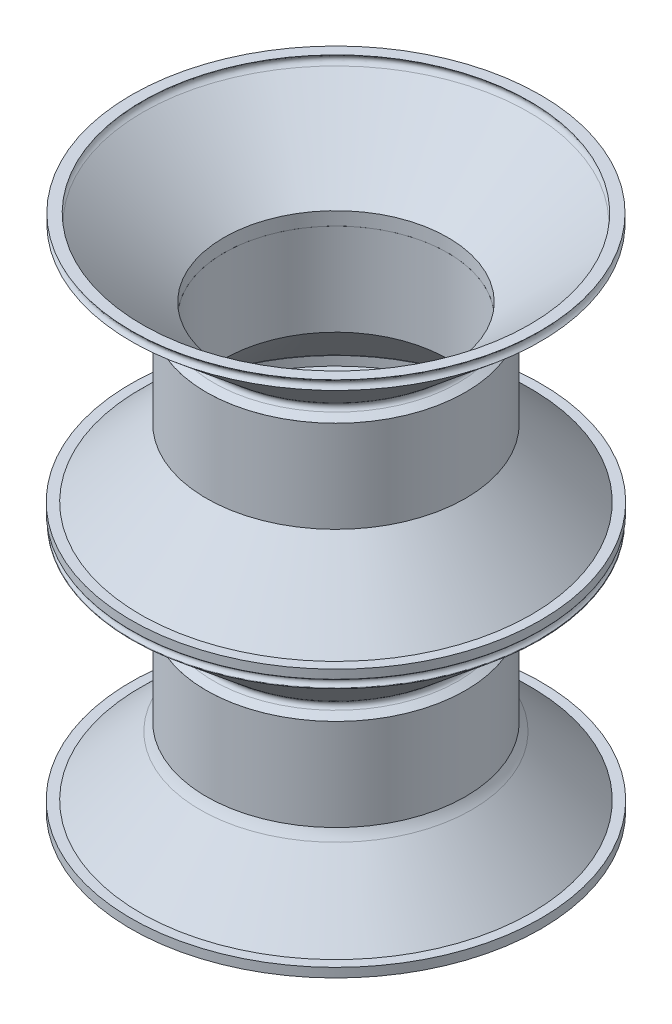
from build123d import *

# Parameters (mm, degrees)
ACTIVE_FILLET_R     = 0.5
SKETCH11_R          = 14.103676921920666
SKETCH11_R_2        = 12.180725781348816
COLLAR_DEPTH        = 10
SKETCH18_R          = 22.29457906148835
SKETCH18_R_2        = 19.511828541936428
BOSS_EXTRUDE4_DEPTH = 1
FILLET3_R           = 0.05
FILLET4_R           = 0.05
FILLET5_R           = 4


# Read off the part's stored shape, not the designer's step: Body-Move/Copy2
with BuildPart() as part:
    # Sketch1 → Main Active (revolve)
    with BuildSketch(Plane.XY):
        Polygon((-0.44430417046757187, 0), (-9.97833291122136, 8), (-8.733753849733018, 8), (0.08552036891816808, 0.5997502558785777), (0.08552036891816808, -0.8481847341285212), (-1.8374307716536824, -0.8481847341285211), align=None)
    revolve(axis=Axis((12.266246150266982, 7.609018032819944, 0), (1.1e-16, -1, 0)))

    # Active fillet
    active_fillet_edges = [part.edges().sort_by_distance(p)[0] for p in [
        (24.976796471001535, 3.23e-15, -1.56e-15),
    ]]
    fillet(active_fillet_edges, radius=ACTIVE_FILLET_R)

    # Sketch17 → Neck Curve (revolve)
    with BuildSketch(Plane.XY, mode=Mode.PRIVATE) as neck_curve_sk:
        with BuildLine():
            Line((-9.978332911221361, 8), (-8.733753849733016, 8))
            add(Edge.make_bspline(
                [(-8.733753849733016, 8), (-9.417134243608169, 8.454758024892763), (-8.796578828718458, 9.000000000000004)],
                knots=[0, 0, 0, 1, 1, 1], degree=2))
            Line((-8.796578828718458, 9.000000000000004), (-9.978332911221361, 9.000000000000004))
            add(Edge.make_bspline(
                [(-9.978332911221361, 8), (-9.322292514147533, 8.483356916822304), (-9.978332911221361, 9.000000000000004)],
                knots=[0, 0, 0, 1, 1, 1], degree=2))
        make_face()
    revolve(neck_curve_sk.sketch.rotate(Axis((12.266246150266984, -19.969844330252183, 0), (-1.2e-16, 1, 0)), 180), axis=Axis((12.266246150266984, -19.969844330252183, 0), (-1.2e-16, 1, 0)))

    # Fillet3
    fillet3_edges = [part.edges().sort_by_distance(p)[0] for p in [
        (12.266246150266975, 8.000000000000002, -22.24457906148834),
    ]]
    fillet(fillet3_edges, radius=FILLET3_R)


with BuildPart() as body_2:
    # Sketch11 → collar (new body)
    with BuildSketch(Plane.XZ.offset(0.848184734128521)):
        with Locations((12.266246150266984, 0)):
            Circle(SKETCH11_R)
        with Locations((12.266246150266984, 0)):
            Circle(SKETCH11_R_2, mode=Mode.SUBTRACT)
    extrude(amount=COLLAR_DEPTH)

    # Sketch14 → Passive Element (revolve)
    with BuildSketch(Plane.XY, mode=Mode.PRIVATE) as passive_element_sk:
        Polygon((-1.611535905929543, -10.848184734128521), (-8.99263866651715, -18.22928749471616), (-7.295582391669438, -18.22928749471616), (0.08552036891816897, -10.848184734128521), align=None)
    revolve(passive_element_sk.sketch.rotate(Axis((12.266246150266984, -19.969844330252183, 0), (-1.2e-16, 1, 0)), 180), axis=Axis((12.266246150266984, -19.969844330252183, 0), (-1.2e-16, 1, 0)))

    # Sketch18 → Boss-Extrude4 (add)
    with BuildSketch(Plane.XZ.offset(18.22928749471616)):
        with Locations((12.266246150266984, 0)):
            Circle(SKETCH18_R)
        with Locations((12.266246150266984, 0)):
            Circle(SKETCH18_R_2, mode=Mode.SUBTRACT)
    extrude(amount=BOSS_EXTRUDE4_DEPTH)

    # Fillet5
    # the kernel refuses this fillet: 4 mm, written as the material it adds along each edge
    with BuildSketch(Plane(origin=(12.266246150266982, -10.84818473412852, 0), x_dir=(1, 1.3e-16, 1.2e-16), z_dir=(-1.2e-16, 0, 1))) as fillet5_piece_1:
        with BuildLine():
            CenterArc((17.610465682983815, 1.9241706227050854), FILLET5_R, 208.7535216625701, 16.246478337429835)
            Line((14.103676921920679, 5.3e-15), (13.877782056196525, 0))
            Line((13.877782056196525, 0), (14.782038558237621, -0.9042565020411005))
        make_face()
    revolve(axis=Axis((12.266246150266982, -10.84818473412852, 0), (-1.2e-16, 1, 0)))


with BuildPart() as body_3:
    # Body-Move/Copy2 outline → Body-Move/Copy2 (revolve)
    with BuildSketch(Plane(origin=(12.26624615, 0, 0), x_dir=(1, 0, 0), z_dir=(0, 0, 1))):
        with BuildLine():
            Line((14.103676922, 27.251815266), (13.305602068, 27.737711456))
            ThreePointArc((13.305602068, 27.737711456), (13.067048008, 28.127010025), (13.24422527, 28.547806453))
            Line((13.24422527, 28.547806453), (22.244579061, 36.1))
            add(Edge.make_bspline(
                [(22.244579061, 37.1), (21.58853866441453, 36.5833569168223), (22.244579061, 36.1)],
                knots=[0, 0, 0, 1, 1, 1], degree=2))
            Line((22.244579061, 37.1), (21.062824979, 37.1))
            add(Edge.make_bspline(
                [(21.062824979, 37.1), (21.683380393875147, 36.55475802489277), (21, 36.1)],
                knots=[0.04818103665717954, 0.04818103665717954, 0.04818103665717954, 1.0481810366571813, 1.0481810366571813, 1.0481810366571813], degree=2))
            Line((21, 36.1), (12.180725781, 28.699750256))
            Line((12.180725781, 28.699750256), (12.180725781, 27.251815266))
            Line((12.180725781, 27.251815266), (14.103676922, 27.251815266))
        make_face()
    revolve(axis=Axis((12.26624615, 0, 0), (0, 1, 0)))


with BuildPart() as body_4:
    # Body-Move_Copy2 2 outline → Body-Move_Copy2 2 (revolve)
    with BuildSketch(Plane(origin=(12.26624615, 0, 0), x_dir=(1, 0, 0), z_dir=(0, 0, 1))):
        Polygon((13.877782056, 17.251815266), (14.103676922, 17.251815266), (14.103676922, 27.251815266), (12.180725781, 27.251815266), (12.180725781, 17.251815266), (19.561828542, 9.870712505), (19.511828542, 9.870712505), (19.511828542, 8.870712505), (22.294579061, 8.870712505), (22.294579061, 9.870712505), (21.258884817, 9.870712505), align=None)
    revolve(axis=Axis((12.26624615, 0, 0), (0, 1, 0)))

    # Fillet4
    fillet4_edges = [body_4.edges().sort_by_distance(p)[0] for p in [
        (-10.028332911, 8.870712505, -2.73e-15),
    ]]
    fillet(fillet4_edges, radius=FILLET4_R)


solid = Compound([part.part, body_2.part, body_3.part, body_4.part])
